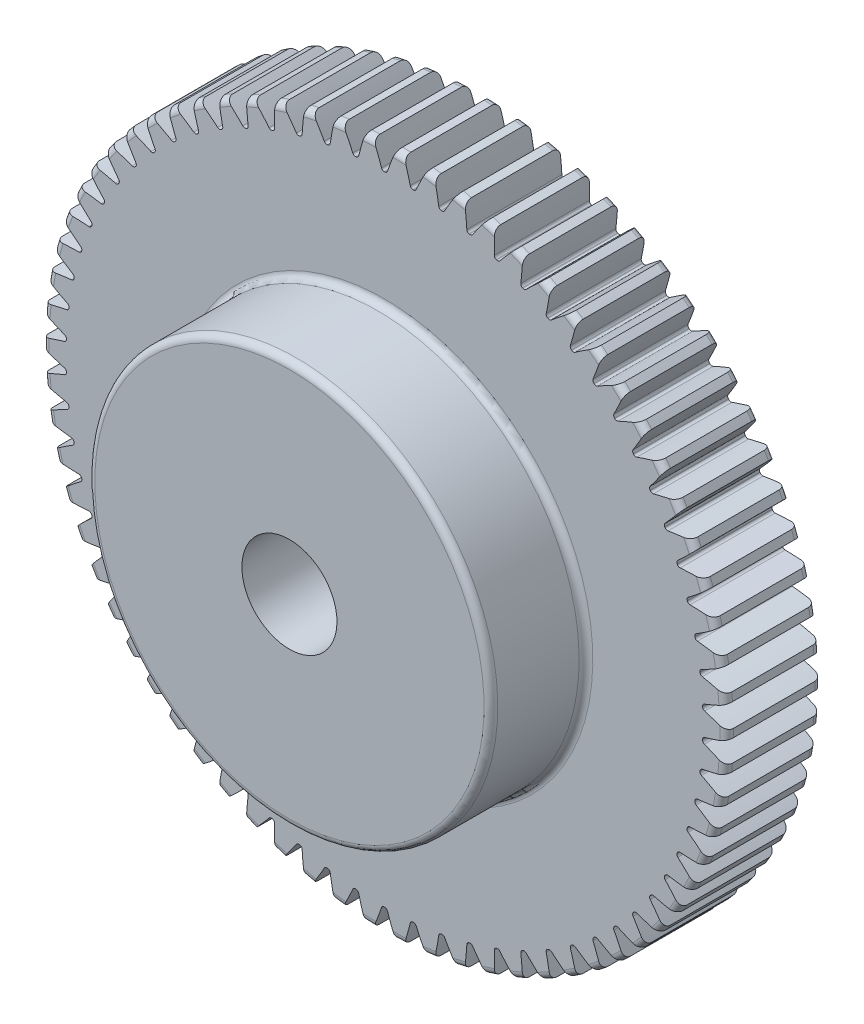
from build123d import *

# Parameters (mm, degrees)
FILLET2_R          = 0.9144
CUT_EXTRUDE2_DEPTH = 66.893298736
CIRPATTERN1_COUNT  = 70
FILLET3_R          = 1.016


with BuildPart() as part:
    # Sketch4 → Revolve1 (revolve)
    with BuildSketch(Plane(origin=(0, 0, 0), x_dir=(0, 0, -1), z_dir=(1, 0, 0))):
        Polygon((-25.4, 6.35), (-25.4, 26.924), (-12.7, 26.924), (-12.7, 45.72), (0, 45.72), (0, 6.35), align=None)
    revolve(axis=Axis((0, 0, 12.7), (0, 0, 1)))

    # Fillet2
    fillet2_edges = [part.edges().sort_by_distance(p)[0] for p in [
        (0, -26.924, 25.4),
        (0, -26.924, 12.7),
        (0, -45.72, 12.7),
        (0, -45.72, 0),
    ]]
    fillet(fillet2_edges, radius=FILLET2_R)

    # Sketch7 → Cut-Extrude2 (cut, through all)
    with BuildSketch(Plane.XY.offset(12.7)):
        with BuildLine():
            ThreePointArc((-0.035776995, 42.544984957), (0, 42.545), (0.035776995, 42.544984957))
            ThreePointArc((0.035776995, 42.544984957), (0.257128983, 42.615646356), (0.396284661, 42.80172546))
            ThreePointArc((0.396284661, 42.80172546), (0.927425025, 44.258110998), (1.50902682, 45.695089868))
            ThreePointArc((1.50902682, 45.695089868), (0, 45.72), (-1.50902682, 45.695089868))
            ThreePointArc((-1.50902682, 45.695089868), (-0.927425025, 44.258110998), (-0.396284661, 42.80172546))
            ThreePointArc((-0.396284661, 42.80172546), (-0.257128983, 42.615646356), (-0.035776995, 42.544984957))
        make_face()
    cut_extrude2 = extrude(amount=-CUT_EXTRUDE2_DEPTH, mode=Mode.SUBTRACT)

    # CirPattern1: Cut-Extrude2 ×70 about axis
    cirpattern1_axis = Axis((0, 0, 25.4), (0, 0, -1))
    for i in range(1, CIRPATTERN1_COUNT):
        add(cut_extrude2.rotate(cirpattern1_axis, i * 360 / CIRPATTERN1_COUNT), mode=Mode.SUBTRACT)

    # Fillet3
    fillet3_edges = [part.edges().sort_by_distance(p)[0] for p in [
        (0, -6.35, 0),
    ]]
    fillet(fillet3_edges, radius=FILLET3_R)


solid = part.part
